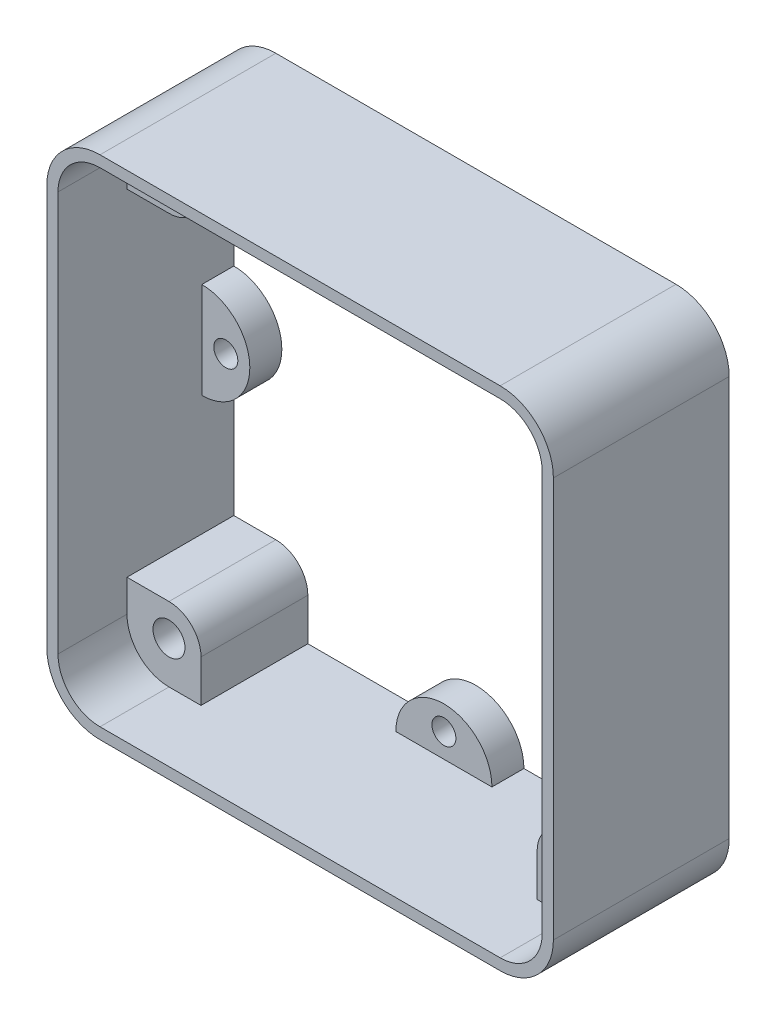
from build123d import *

# Parameters (mm, degrees)
BOSS_EXTRUDE1_DEPTH      = 7
BOSS_EXTRUDE1_DEPTH_BACK = 14.970201
BOSS_EXTRUDE2_START      = -14.970201
SKETCH2_R                = 2
BOSS_EXTRUDE2_DEPTH      = 13.350798149
BOSS_EXTRUDE3_START      = -14.970203
SKETCH3_R                = 1.5
BOSS_EXTRUDE3_DEPTH      = 4.000003


with BuildPart() as part:
    # Sketch1 → Boss-Extrude1 (new, two sides: drawn at the far end of the back side and taken through both)
    with BuildSketch(Plane.XY.offset(-BOSS_EXTRUDE1_DEPTH_BACK)):
        with BuildLine():
            Line((54.999742941, -1.649999966), (5.000257256, -1.649999966))
            ThreePointArc((5.000257256, -1.649999966), (0.297273819, 0.297273819), (-1.649999966, 5.000257256))
            Line((-1.649999966, 5.000257256), (-1.649999966, 54.999742941))
            ThreePointArc((-1.649999966, 54.999742941), (0.297274177, 59.702725823), (5.000257059, 61.649999966))
            Line((5.000257059, 61.649999966), (54.999743139, 61.649999966))
            ThreePointArc((54.999743139, 61.649999966), (59.702725466, 59.702725466), (61.649999966, 54.999743139))
            Line((61.649999966, 54.999743139), (61.649999966, 5.000257059))
            ThreePointArc((61.649999966, 5.000257059), (59.702725823, 0.297274177), (54.999742941, -1.649999966))
        make_face()
        with BuildLine():
            ThreePointArc((5.000039752, 60.249999994), (1.287223653, 58.712776347), (-0.249999994, 54.999960248))
            Line((-0.249999994, 54.999960248), (-0.249999994, 5.000039782))
            ThreePointArc((-0.249999994, 5.000039782), (1.287223296, 1.287223296), (5.000039782, -0.249999994))
            Line((5.000039782, -0.249999994), (54.999960248, -0.249999994))
            ThreePointArc((54.999960248, -0.249999994), (58.712776347, 1.287223653), (60.249999994, 5.000039752))
            Line((60.249999994, 5.000039752), (60.249999994, 54.999960279))
            ThreePointArc((60.249999994, 54.999960279), (58.712775989, 58.712775989), (54.999960279, 60.249999994))
            Line((54.999960279, 60.249999994), (5.000039752, 60.249999994))
        make_face(mode=Mode.SUBTRACT)
    extrude(amount=BOSS_EXTRUDE1_DEPTH + BOSS_EXTRUDE1_DEPTH_BACK)


with BuildPart() as boss_extrude2_tool:
    # Sketch2 → Boss-Extrude2 (new body)
    # profile 1 of 4: a face of its own
    with BuildSketch(Plane.XY.offset(BOSS_EXTRUDE2_START)):
        with BuildLine():
            Line((9.00000016, 54.99999922), (9.00000016, 60.249999994))
            Line((9.00000016, 60.249999994), (5.000039752, 60.249999994))
            add(Edge.make_bspline(
                [(-0.249999994, 54.999960248), (-0.250954892, 58.075921633), (1.924078367, 60.250954892), (5.000039752, 60.249999994)],
                knots=[0, 0, 0, 0, 1, 1, 1, 1], degree=3, weights=[1, 0.804591489, 0.804591489, 1]))
            Line((-0.249999994, 54.999960248), (-0.249999994, 50.99999922))
            Line((-0.249999994, 50.99999922), (5.00000016, 50.99999922))
            ThreePointArc((5.00000016, 50.99999922), (7.828427285, 52.171572095), (9.00000016, 54.99999922))
        make_face()
        with Locations(Location((5.00000016, 54.99999922, 0), (0, 0, 90))):
            Circle(SKETCH2_R, mode=Mode.SUBTRACT)
    # profile 2 of 4: a face of its own
    with BuildSketch(Plane.XY.offset(BOSS_EXTRUDE2_START)):
        with BuildLine():
            Line((50.99999922, 54.99999984), (50.99999922, 60.249999994))
            Line((50.99999922, 60.249999994), (54.999960248, 60.249999994))
            add(Edge.make_bspline(
                [(54.999960248, 60.249999994), (58.075921633, 60.250954892), (60.250954892, 58.075921633), (60.249999994, 54.999960248)],
                knots=[0, 0, 0, 0, 1, 1, 1, 1], degree=3, weights=[1, 0.804591489, 0.804591489, 1]))
            Line((60.249999994, 54.999960248), (60.249999994, 50.99999984))
            Line((60.249999994, 50.99999984), (54.99999922, 50.99999984))
            ThreePointArc((54.99999922, 50.99999984), (52.171572095, 52.171572715), (50.99999922, 54.99999984))
        make_face()
        with Locations(Location((54.99999922, 54.99999984, 0), (0, 0, 90))):
            Circle(SKETCH2_R, mode=Mode.SUBTRACT)
    # profile 3 of 4: a face of its own
    with BuildSketch(Plane.XY.offset(BOSS_EXTRUDE2_START)):
        with BuildLine():
            Line((54.99999984, 9.00000078), (60.249999994, 9.00000078))
            Line((60.249999994, 9.00000078), (60.249999994, 5.000039752))
            add(Edge.make_bspline(
                [(60.249999994, 5.000039752), (60.250954892, 1.924078367), (58.075921633, -0.250954892), (54.999960248, -0.249999994)],
                knots=[0, 0, 0, 0, 1, 1, 1, 1], degree=3, weights=[1, 0.804591489, 0.804591489, 1]))
            Line((54.999960248, -0.249999994), (50.99999984, -0.249999994))
            Line((50.99999984, -0.249999994), (50.99999984, 5.00000078))
            ThreePointArc((50.99999984, 5.00000078), (52.171572715, 7.828427905), (54.99999984, 9.00000078))
        make_face()
        with Locations(Location((54.99999984, 5.00000078, 0), (0, 0, 90))):
            Circle(SKETCH2_R, mode=Mode.SUBTRACT)
    # profile 4 of 4: a face of its own
    with BuildSketch(Plane.XY.offset(BOSS_EXTRUDE2_START)):
        with BuildLine():
            Line((9.00000078, 5.00000016), (9.00000078, -0.249999994))
            Line((9.00000078, -0.249999994), (5.000039752, -0.249999994))
            add(Edge.make_bspline(
                [(5.000039752, -0.249999994), (1.924078367, -0.250954892), (-0.250954892, 1.924078367), (-0.249999994, 5.000039752)],
                knots=[0, 0, 0, 0, 1, 1, 1, 1], degree=3, weights=[1, 0.804591489, 0.804591489, 1]))
            Line((-0.249999994, 5.000039752), (-0.249999994, 9.00000016))
            Line((-0.249999994, 9.00000016), (5.00000078, 9.00000016))
            ThreePointArc((5.00000078, 9.00000016), (7.828427905, 7.828427285), (9.00000078, 5.00000016))
        make_face()
        with Locations(Location((5.00000078, 5.00000016, 0), (0, 0, 90))):
            Circle(SKETCH2_R, mode=Mode.SUBTRACT)
    extrude(amount=BOSS_EXTRUDE2_DEPTH)


with BuildPart() as part_1:
    add(part.part)


with BuildPart() as part_2:
    # Boss-Extrude2: joined with boss_extrude2_tool
    add(part_1.part.fuse(boss_extrude2_tool.part, tol=0.00001))

    # Sketch3 → Boss-Extrude3 (add)
    # profile 1 of 4: a face of its own
    with BuildSketch(Plane.XY.offset(BOSS_EXTRUDE3_START)):
        with BuildLine():
            Line((60.249999994, 23.999999985), (60.249999994, 35.999999985))
            ThreePointArc((60.249999994, 35.999999985), (54.249999994, 29.999999985), (60.249999994, 23.999999985))
        make_face()
        with Locations(Location((57.249999994, 29.999999985, 0), (0, 0, 180))):
            Circle(SKETCH3_R, mode=Mode.SUBTRACT)
    # profile 2 of 4: a face of its own
    with BuildSketch(Plane.XY.offset(BOSS_EXTRUDE3_START)):
        with BuildLine():
            Line((36.000000015, 60.249999994), (24.000000015, 60.249999994))
            ThreePointArc((24.000000015, 60.249999994), (30.000000015, 54.249999994), (36.000000015, 60.249999994))
        make_face()
        with Locations(Location((30.000000015, 57.249999994, 0), (0, 0, 180))):
            Circle(SKETCH3_R, mode=Mode.SUBTRACT)
    # profile 3 of 4: a face of its own
    with BuildSketch(Plane.XY.offset(BOSS_EXTRUDE3_START)):
        with BuildLine():
            Line((23.999999985, -0.249999994), (35.999999985, -0.249999994))
            ThreePointArc((35.999999985, -0.249999994), (29.999999985, 5.750000006), (23.999999985, -0.249999994))
        make_face()
        with Locations(Location((29.999999985, 2.750000006, 0), (0, 0, 180))):
            Circle(SKETCH3_R, mode=Mode.SUBTRACT)
    # profile 4 of 4: a face of its own
    with BuildSketch(Plane.XY.offset(BOSS_EXTRUDE3_START)):
        with BuildLine():
            Line((-0.249999994, 36.000000015), (-0.249999994, 24.000000015))
            ThreePointArc((-0.249999994, 24.000000015), (5.750000006, 30.000000015), (-0.249999994, 36.000000015))
        make_face()
        with Locations(Location((2.750000006, 30.000000015, 0), (0, 0, 180))):
            Circle(SKETCH3_R, mode=Mode.SUBTRACT)
    extrude(amount=BOSS_EXTRUDE3_DEPTH)


solid = part_2.part
